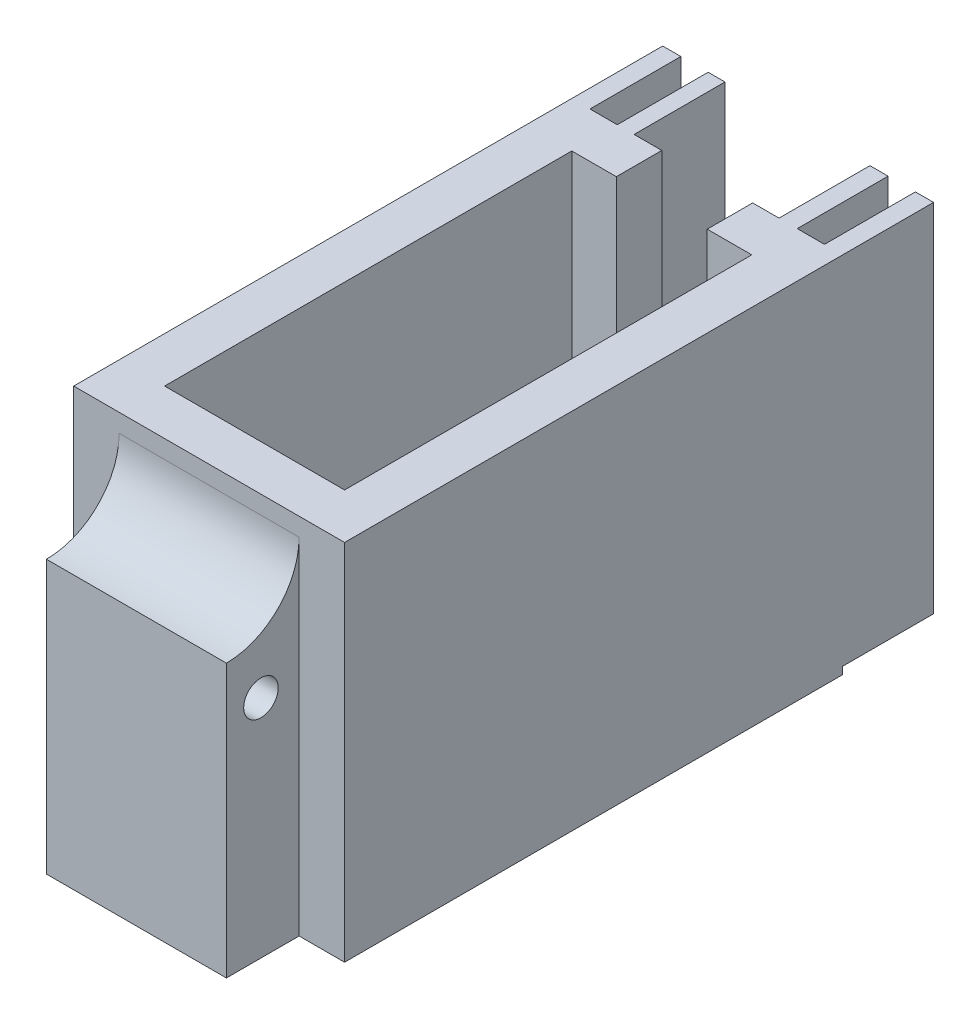
from build123d import *

# Parameters (mm, degrees)
BOSS_EXTRUDE1_DEPTH     = 50.8
CUT_EXTRUDE1_DEPTH      = 92.455090356
CUT_EXTRUDE1_DEPTH_BACK = 50.8
SKETCH4_W               = 37.846
SKETCH4_H               = 12.7
SKETCH4_R               = 2.032
BOSS_EXTRUDE2_DEPTH     = 4.572
SKETCH7_W               = 2.54
SKETCH7_H               = 12.7
SKETCH7_W_2             = 2.353491512
BOSS_EXTRUDE3_DEPTH     = 45.212
BOSS_EXTRUDE4_DEPTH     = 37.846
FILLET1_R               = 10.16
SKETCH9_W               = 6.35
SKETCH9_H               = 13.184190116
CUT_EXTRUDE2_DEPTH      = 94.73231429


with BuildPart() as part:
    # Sketch1 → Boss-Extrude1 (new body)
    with BuildSketch(Plane(origin=(0, 0, 0), x_dir=(1, 0, 0), z_dir=(0, 1, 0))):
        Polygon((-24.306, -56.0525), (-24.306, -27.6045), (-30.656, -27.6045), (-30.656, -62.4025), (7.19, -62.4025), (7.19, 7.1935), (-11.733, 7.1935), (-11.733, 0.8435), (0.84, 0.8435), (0.84, -56.0525), align=None)
        Polygon((-24.306, -27.6045), (-24.306, 0.8435), (-11.733, 0.8435), (-11.733, 7.1935), (-30.656, 7.1935), (-30.656, -27.6045), align=None)
    extrude(amount=BOSS_EXTRUDE1_DEPTH)

    # Sketch3 → Cut-Extrude1 (cut, two sides: drawn at the far end of the back side and taken through both)
    with BuildSketch(Plane(origin=(0, 0, -7.1935), x_dir=(-1, 0, 0), z_dir=(0, 0, -1)).offset(-CUT_EXTRUDE1_DEPTH_BACK)):
        Polygon((5.383, 29.21), (11.733, 29.21), (18.083, 29.21), (18.083, 50.8), (5.383, 50.8), align=None)
    extrude(amount=CUT_EXTRUDE1_DEPTH + CUT_EXTRUDE1_DEPTH_BACK, mode=Mode.SUBTRACT)

    # Sketch4 → Boss-Extrude2 (add)
    with BuildSketch(Plane(origin=(0, 1.016, 0), x_dir=(1, 0, 0), z_dir=(0, 1, 0))):
        with Locations((-11.733, 13.5435)):
            Rectangle(SKETCH4_W, SKETCH4_H)
        with Locations(Location((-18.083, 13.7975, 0), (0, 0, 270))):
            Circle(SKETCH4_R, mode=Mode.SUBTRACT)
        with Locations(Location((-5.383, 13.7975, 0), (0, 0, 270))):
            Circle(SKETCH4_R, mode=Mode.SUBTRACT)
    extrude(amount=BOSS_EXTRUDE2_DEPTH)

    # Sketch7 → Boss-Extrude3 (add)
    with BuildSketch(Plane(origin=(0, 5.588, 0), x_dir=(1, 0, 0), z_dir=(0, 1, 0))):
        with Locations((5.92, 13.5435)):
            Rectangle(SKETCH7_W, SKETCH7_H)
        with Locations((-0.43, 13.5435)):
            Rectangle(SKETCH7_W, SKETCH7_H)
        with Locations((-23.129254244, 13.5435)):
            Rectangle(SKETCH7_W_2, SKETCH7_H)
        with Locations((-29.386, 13.5435)):
            Rectangle(SKETCH7_W, SKETCH7_H)
    extrude(amount=BOSS_EXTRUDE3_DEPTH)

    # Sketch8 → Boss-Extrude4 (add)
    with BuildSketch(Plane.ZY.offset(30.656)):
        with BuildLine():
            Line((71.5465, 31.496), (70.1495, 31.496))
            ThreePointArc((70.1495, 31.496), (67.7365, 29.083), (65.3235, 31.496))
            Line((65.3235, 31.496), (62.4025, 31.496))
            Line((62.4025, 31.496), (62.4025, 0))
            Line((62.4025, 0), (71.5465, 0))
            Line((71.5465, 0), (71.5465, 31.496))
        make_face()
        with BuildLine():
            ThreePointArc((65.3235, 31.496), (67.7365, 33.909), (70.1495, 31.496))
            Line((70.1495, 31.496), (71.5465, 31.496))
            Line((71.5465, 31.496), (71.5465, 0))
            Line((71.5465, 0), (72.5625, 0))
            Line((72.5625, 0), (72.5625, 38.1))
            Line((72.5625, 38.1), (62.4025, 38.1))
            Line((62.4025, 38.1), (62.4025, 31.496))
            Line((62.4025, 31.496), (65.3235, 31.496))
        make_face()
    extrude(amount=-BOSS_EXTRUDE4_DEPTH)

    # Fillet1
    fillet1_edges = [part.edges().sort_by_distance(p)[0] for p in [
        (-11.733, 38.1, 62.4025),
    ]]
    fillet(fillet1_edges, radius=FILLET1_R - 0.0001)  # a hair under: the kernel refuses the full size

    # Sketch9 → Cut-Extrude2 (cut, through all)
    with BuildSketch(Plane(origin=(0, 50.8, 0), x_dir=(1, 0, 0), z_dir=(0, 1, 0))):
        with Locations((-27.481, -68.994595058)):
            Rectangle(SKETCH9_W, SKETCH9_H)
        Polygon((7.19, -62.4025), (0.84, -62.4025), (0.84, -76.255559197), (7.295762748, -76.255559197), align=None)
    extrude(amount=-CUT_EXTRUDE2_DEPTH, mode=Mode.SUBTRACT)


solid = part.part
